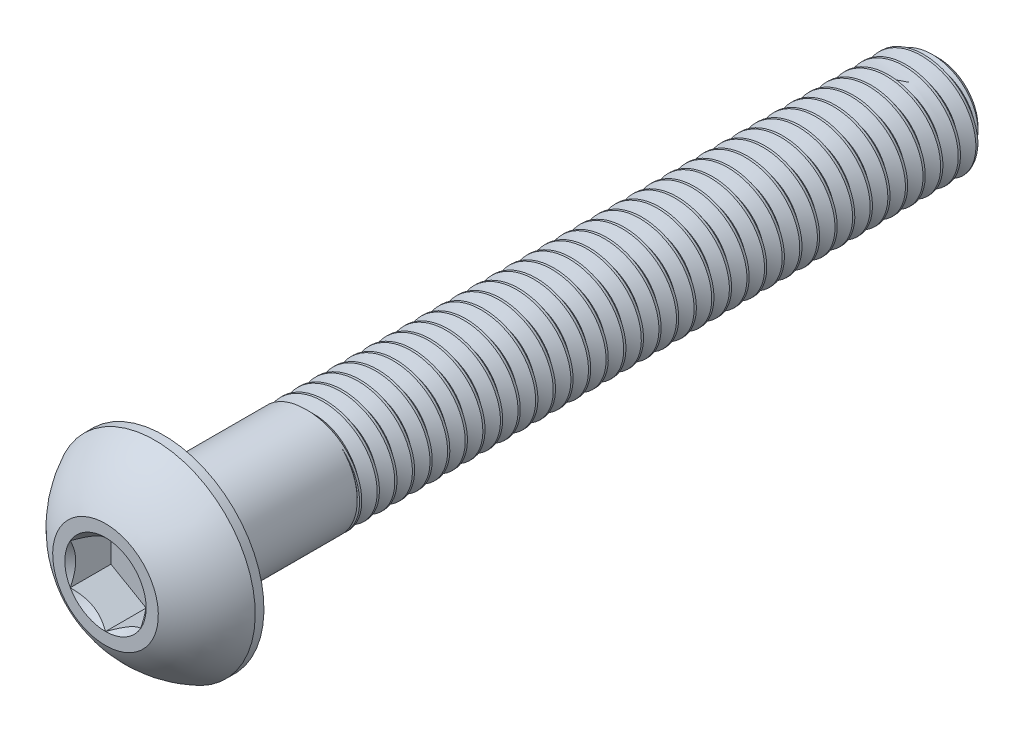
from build123d import *

# Parameters (mm, degrees)
CUT_EXTRUDE2_DEPTH = 1.155
CUT_SWEEP2_PITCH   = 0.5
CUT_SWEEP2_TO      = 18


with BuildPart() as part:
    # Sketch10 → Revolve3 (revolve)
    with BuildSketch(Plane(origin=(0, 0, 0), x_dir=(0, 0, -1), z_dir=(1, 0, 0)), mode=Mode.PRIVATE) as revolve3_sk:
        Polygon((10.625, 1.5), (11, 1.125), (11, 0), (-11, 0), (-11, 1.5), align=None)
    revolve(revolve3_sk.sketch.rotate(Axis((0, 0, 12.65), (0, 0, -1)), 180), axis=Axis((0, 0, 12.65), (0, 0, -1)))

    # Sketch7 → Revolve2 (revolve)
    with BuildSketch(Plane(origin=(0, 0, 0), x_dir=(0, 0, -1), z_dir=(1, 0, 0)), mode=Mode.PRIVATE) as revolve2_sk:
        with BuildLine():
            Line((-11.2475, 2.85), (-11, 2.85))
            Line((-11, 2.85), (-11, 0))
            Line((-11, 0), (-12.65, 0))
            Line((-12.65, 0), (-12.65, 1.5))
            ThreePointArc((-12.65, 1.5), (-12.05487489, 2.285251969), (-11.2475, 2.85))
        make_face()
    revolve(revolve2_sk.sketch.rotate(Axis((0, 0, 12.65), (0, 0, -1)), 180), axis=Axis((0, 0, 12.65), (0, 0, -1)))

    # Sketch5 → Cut-Extrude2 (cut)
    with BuildSketch(Plane.XY.offset(12.65)):
        Polygon((1, -0.577350269), (1, 0.577350269), (0, 1.154700538), (-1, 0.577350269), (-1, -0.577350269), (0, -1.154700538), align=None)
    extrude(amount=-CUT_EXTRUDE2_DEPTH, mode=Mode.SUBTRACT)

    # Cut-Extrude3 cone 1 section (through the dimple's axis) → Cut-Extrude3 (revolve, cut)
    with BuildSketch(Plane(origin=(0, 0, 12.65), x_dir=(0, -1, 0), z_dir=(1, 0, 0))):
        Polygon((0, 0), (1.154700538, 0), (0, 1.154700538), align=None)
    revolve(axis=Axis((0, 0, 12.65), (0, 0, -1)), mode=Mode.SUBTRACT)


with BuildPart() as body_2:
    # Split1: the piece on the far side of the plane
    add(part.part)
    split(bisect_by=Plane.XY.offset(7), keep=Keep.BOTTOM)

    # Cut-Sweep2: arcs per turn and ends read off the stored shape
    # Cut-Sweep2: the profile of Sketch12 screwed along a right-hand helix through 39.3 turns, 6 arcs to a turn; built about Z, then put on its axis
    cut_sweep2_z = Axis((0, 0, 0), (0, 0, 1))
    cut_sweep2_corners = [(1.175240474, 0, -0.1875), (1.175240474, 0, -0.25), (1.527063294, 0, -0.453125), (1.527063294, 0, 0.015625)]
    with BuildLine(mode=Mode.PRIVATE) as cut_sweep2_profile:
        Line(cut_sweep2_corners[0], cut_sweep2_corners[1])
        Line(cut_sweep2_corners[1], cut_sweep2_corners[2])
        Line(cut_sweep2_corners[2], cut_sweep2_corners[3])
        Line(cut_sweep2_corners[3], cut_sweep2_corners[0])
    cut_sweep2_cap = Face(cut_sweep2_profile.wire())
    cut_sweep2_turn_angles = [0, 30, 60, 90, 120, 150, 180, 210, 240, 270, 300, 330, 360]
    cut_sweep2_turn_weights = [1, 0.8660254037844387, 1, 0.8660254037844387, 1, 0.8660254037844387, 1, 0.8660254037844387, 1, 0.8660254037844387, 1, 0.8660254037844387, 1]
    cut_sweep2_turn_rails = [Edge.make_bspline([Vector(p[0], p[1], 0).rotate(cut_sweep2_z, cut_sweep2_turn_angles[k]) / cut_sweep2_turn_weights[k] + Vector(0, 0, p[2] + CUT_SWEEP2_PITCH * cut_sweep2_turn_angles[k] / 360) for k in range(13)], [0, 0, 0, 1, 1, 2, 2, 3, 3, 4, 4, 5, 5, 6, 6, 6], 2, cut_sweep2_turn_weights) for p in cut_sweep2_corners]
    cut_sweep2_turn_sides = [Face.make_surface_from_curves(cut_sweep2_turn_rails[p[0]], cut_sweep2_turn_rails[p[1]]) for p in [(0, 1), (1, 2), (2, 3), (3, 0)]]
    cut_sweep2_last_angles = [14040, 14070, 14100, 14124, 14148]
    cut_sweep2_last_weights = [1, 0.8660254037844387, 1, 0.913545457642801, 1]
    cut_sweep2_last_rails = [Edge.make_bspline([Vector(p[0], p[1], 0).rotate(cut_sweep2_z, cut_sweep2_last_angles[k]) / cut_sweep2_last_weights[k] + Vector(0, 0, p[2] + CUT_SWEEP2_PITCH * cut_sweep2_last_angles[k] / 360) for k in range(5)], [0, 0, 0, 1, 1, 2, 2, 2], 2, cut_sweep2_last_weights) for p in cut_sweep2_corners]
    cut_sweep2_last_sides = [Face.make_surface_from_curves(cut_sweep2_last_rails[p[0]], cut_sweep2_last_rails[p[1]]) for p in [(0, 1), (1, 2), (2, 3), (3, 0)]]
    cut_sweep2 = Plane(origin=(0, 0, -11), x_dir=(0, 1, 0), z_dir=(0, 0, 1)) * split(Solid(Shell([*[p.moved(Location((0, 0, CUT_SWEEP2_PITCH * i))) for i in range(39) for p in cut_sweep2_turn_sides], *cut_sweep2_last_sides, cut_sweep2_cap, cut_sweep2_cap.rotate(cut_sweep2_z, 14148).moved(Location((0, 0, CUT_SWEEP2_PITCH * 14148 / 360)))])), bisect_by=Plane.XY.offset(CUT_SWEEP2_TO), keep=Keep.BOTTOM, mode=Mode.PRIVATE)
    add(cut_sweep2, mode=Mode.SUBTRACT)


with BuildPart() as part_1:
    add(part.part)

    # Split1
    split(bisect_by=Plane.XY.offset(7), keep=Keep.TOP)

    add(body_2.part)  # Boss-Extrude1 merges body 2
    # Boss-Extrude1 cone 1 section (through the dimple's axis) → Boss-Extrude1 (revolve)
    with BuildSketch(Plane(origin=(0, 0, 7), x_dir=(0, -1, 0), z_dir=(1, 0, 0))):
        Polygon((0, 0), (1.5, 0), (0, 1.5), align=None)
    revolve(axis=Axis((0, 0, 7), (0, 0, -1)))


solid = part_1.part
